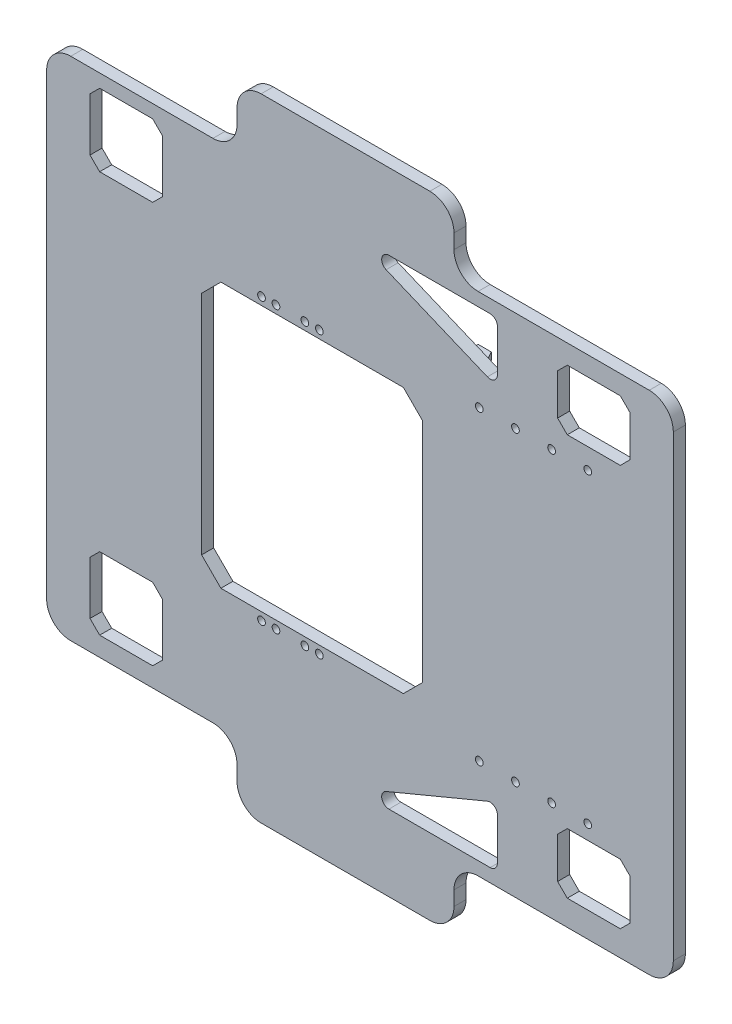
from build123d import *

# Parameters (mm, degrees)
EXTRUDE_1_DEPTH       = 5
CUT_EXTRUDE_1_DEPTH   = 185.623942109
CUT_EXTRUDE_2_DEPTH   = 185.623942109
EXTRUDE_2_DEPTH       = 15
CUT_EXTRUDE_3_DEPTH   = 10
CUT_EXTRUDE_4_DEPTH   = 10
MIRROR_2_COPY_1_DEPTH = 15
MIRROR_2_COPY_2_DEPTH = 10
MIRROR_2_COPY_3_DEPTH = 10
MIRROR_2_COPY_4_DEPTH = 15
MIRROR_2_COPY_5_DEPTH = 10
MIRROR_2_COPY_6_DEPTH = 10
SKETCH_7_R            = 1.6
CUT_EXTRUDE_5_DEPTH   = 186.16479147
SKETCH_8_R            = 1.6
CUT_EXTRUDE_6_DEPTH   = 186.16479147


with BuildPart() as part:
    # 草图1 → 凸台-拉伸1 (new body)
    with BuildSketch(Plane.XY):
        with BuildLine():
            Line((-51, 115), (-51, 121))
            ThreePointArc((-51, 121), (-48.071067812, 128.071067812), (-41, 131))
            Line((-41, 131), (29, 131))
            ThreePointArc((29, 131), (36.071067812, 128.071067812), (39, 121))
            Line((39, 121), (39, 115))
            ThreePointArc((39, 115), (41.928932188, 107.928932188), (49, 105))
            Line((49, 105), (120, 105))
            ThreePointArc((120, 105), (127.071067812, 102.071067812), (130, 95))
            Line((130, 95), (130, -95))
            ThreePointArc((130, -95), (127.071067812, -102.071067812), (120, -105))
            Line((120, -105), (49, -105))
            ThreePointArc((49, -105), (41.928932188, -107.928932188), (39, -115))
            Line((39, -115), (39, -121))
            ThreePointArc((39, -121), (36.071067812, -128.071067812), (29, -131))
            Line((29, -131), (-41, -131))
            ThreePointArc((-41, -131), (-48.071067812, -128.071067812), (-51, -121))
            Line((-51, -121), (-51, -115))
            ThreePointArc((-51, -115), (-53.928932188, -107.928932188), (-61, -105))
            Line((-61, -105), (-120, -105))
            ThreePointArc((-120, -105), (-127.071067812, -102.071067812), (-130, -95))
            Line((-130, -95), (-130, 95))
            ThreePointArc((-130, 95), (-127.071067812, 102.071067812), (-120, 105))
            Line((-120, 105), (-61, 105))
            ThreePointArc((-61, 105), (-53.928932188, 107.928932188), (-51, 115))
        make_face()
    extrude(amount=EXTRUDE_1_DEPTH)

    # 草图2 → 切除-拉伸1 (cut, through all)
    with BuildSketch(Plane.XY.offset(5)):
        with BuildLine():
            Line((10.846153846, -93.730769231), (52.846153846, -76.230769231))
            ThreePointArc((52.846153846, -76.230769231), (55.664100589, -76.503849117), (57, -79))
            Line((57, -79), (57, -96.5))
            ThreePointArc((57, -96.5), (56.121320344, -98.621320344), (54, -99.5))
            Line((54, -99.5), (12, -99.5))
            ThreePointArc((12, -99.5), (9.058257973, -97.088348405), (10.846153846, -93.730769231))
        make_face()
        Polygon((-108, 99.5), (-86, 99.5), (-82, 95.5), (-82, 73.5), (-86, 69.5), (-108, 69.5), (-112, 73.5), (-112, 95.5), align=None)
        Polygon((-108, -67), (-86, -67), (-82, -71), (-82, -93), (-86, -97), (-108, -97), (-112, -93), (-112, -71), align=None)
        Polygon((86, 97), (108, 97), (112, 93), (112, 76), (108, 72), (86, 72), (82, 76), (82, 93), align=None)
        Polygon((86, -69.5), (108, -69.5), (112, -73.5), (112, -90.5), (108, -94.5), (86, -94.5), (82, -90.5), (82, -73.5), align=None)
        with BuildLine():
            Line((12, 99.5), (54, 99.5))
            ThreePointArc((54, 99.5), (56.121320344, 98.621320344), (57, 96.5))
            Line((57, 96.5), (57, 79))
            ThreePointArc((57, 79), (55.664100589, 76.503849117), (52.846153846, 76.230769231))
            Line((52.846153846, 76.230769231), (10.846153846, 93.730769231))
            ThreePointArc((10.846153846, 93.730769231), (9.058257973, 97.088348405), (12, 99.5))
        make_face()
    extrude(amount=-CUT_EXTRUDE_1_DEPTH, mode=Mode.SUBTRACT)

    # 草图3 → 切除-拉伸2 (cut, through all)
    with BuildSketch(Plane(origin=(0, 0, 0), x_dir=(-1, 0, 0), z_dir=(0, 0, -1))):
        Polygon((57.7, 55), (-18, 55), (-26, 47), (-26, -47), (-18, -55), (57.7, -55), (65.7, -47), (65.7, 47), align=None)
    extrude(amount=-CUT_EXTRUDE_2_DEPTH, mode=Mode.SUBTRACT)

    # 草图4 → 凸台-拉伸2 (add)
    with BuildSketch(Plane(origin=(0, 0, 0), x_dir=(-1, 0, 0), z_dir=(0, 0, -1))):
        Polygon((-29, -55), (-29, -66), (-40, -66), (-40, -63), (-32, -63), (-32, -55), align=None)
    extrude_2 = extrude(amount=EXTRUDE_2_DEPTH)

    # 草图5 → 切除-拉伸3 (cut)
    with BuildSketch(Plane.XZ.offset(66)):
        Polygon((40, -5), (34.5, -15), (40, -15), align=None)
    cut_extrude_3 = extrude(amount=-CUT_EXTRUDE_3_DEPTH, mode=Mode.SUBTRACT)

    # 草图6 → 切除-拉伸4 (cut)
    with BuildSketch(Plane.ZY.offset(-29)):
        Polygon((-15, -60.5), (-5, -55), (-15, -55), align=None)
    cut_extrude_4 = extrude(amount=-CUT_EXTRUDE_4_DEPTH, mode=Mode.SUBTRACT)

    # 镜向1: 凸台-拉伸2, 切除-拉伸3, 切除-拉伸4 across plane
    add(extrude_2.mirror(Plane.ZY.offset(-72)))
    add(cut_extrude_3.mirror(Plane.ZY.offset(-72)), mode=Mode.SUBTRACT)
    add(cut_extrude_4.mirror(Plane.ZY.offset(-72)), mode=Mode.SUBTRACT)

    # 镜向2 copy 1 sketch → 镜向2 copy 1 (add)
    with BuildSketch(Plane(origin=(144, 0, 0), x_dir=(1, 0, 0), z_dir=(0, 0, -1))):
        Polygon((-29, -55), (-29, -66), (-40, -66), (-40, -63), (-32, -63), (-32, -55), align=None)
    extrude(amount=MIRROR_2_COPY_1_DEPTH)

    # 镜向2 copy 2 sketch → 镜向2 copy 2 (cut)
    with BuildSketch(Plane(origin=(144, 66, 0), x_dir=(-1, 0, 0), z_dir=(0, 1, 0))):
        Polygon((40, -5), (34.5, -15), (40, -15), align=None)
    extrude(amount=-MIRROR_2_COPY_2_DEPTH, mode=Mode.SUBTRACT)

    # 镜向2 copy 3 sketch → 镜向2 copy 3 (cut)
    with BuildSketch(Plane(origin=(115, 0, 0), x_dir=(0, 0, 1), z_dir=(1, 0, 0))):
        Polygon((-15, -60.5), (-5, -55), (-15, -55), align=None)
    extrude(amount=-MIRROR_2_COPY_3_DEPTH, mode=Mode.SUBTRACT)

    # 镜向2 copy 4 sketch → 镜向2 copy 4 (add)
    with BuildSketch(Plane(origin=(0, 0, 0), x_dir=(-1, 0, 0), z_dir=(0, 0, -1))):
        Polygon((-29, 55), (-29, 66), (-40, 66), (-40, 63), (-32, 63), (-32, 55), align=None)
    extrude(amount=MIRROR_2_COPY_4_DEPTH)

    # 镜向2 copy 5 sketch → 镜向2 copy 5 (cut)
    with BuildSketch(Plane(origin=(0, 66, 0), x_dir=(1, 0, 0), z_dir=(0, 1, 0))):
        Polygon((40, 5), (34.5, 15), (40, 15), align=None)
    extrude(amount=-MIRROR_2_COPY_5_DEPTH, mode=Mode.SUBTRACT)

    # 镜向2 copy 6 sketch → 镜向2 copy 6 (cut)
    with BuildSketch(Plane.ZY.offset(-29)):
        Polygon((-15, 60.5), (-5, 55), (-15, 55), align=None)
    extrude(amount=-MIRROR_2_COPY_6_DEPTH, mode=Mode.SUBTRACT)

    # 草图7 → 切除-拉伸5 (cut, through all)
    with BuildSketch(Plane(origin=(0, 0, 0), x_dir=(-1, 0, 0), z_dir=(0, 0, -1))):
        with Locations((16.85, -58.25)):
            Circle(SKETCH_7_R)
        with Locations((22.85, -58.25)):
            Circle(SKETCH_7_R)
        with Locations((40.85, -58.25)):
            Circle(SKETCH_7_R)
        with Locations((34.85, -58.25)):
            Circle(SKETCH_7_R)
    cut_extrude_5 = extrude(amount=-CUT_EXTRUDE_5_DEPTH, mode=Mode.SUBTRACT)

    # 镜向3: 切除-拉伸5 across plane
    add(cut_extrude_5.mirror(Plane.ZX), mode=Mode.SUBTRACT)

    # 草图8 → 切除-拉伸6 (cut, through all)
    with BuildSketch(Plane(origin=(0, 0, 0), x_dir=(-1, 0, 0), z_dir=(0, 0, -1))):
        with Locations((-49.5, -63.495385915)):
            Circle(SKETCH_8_R)
        with Locations((-64.5, -63.495385915)):
            Circle(SKETCH_8_R)
        with Locations((-79.5, -63.495385915)):
            Circle(SKETCH_8_R)
        with Locations((-94.5, -63.495385915)):
            Circle(SKETCH_8_R)
    cut_extrude_6 = extrude(amount=-CUT_EXTRUDE_6_DEPTH, mode=Mode.SUBTRACT)

    # 镜向4: 切除-拉伸6 across plane
    add(cut_extrude_6.mirror(Plane.ZX), mode=Mode.SUBTRACT)


solid = part.part
